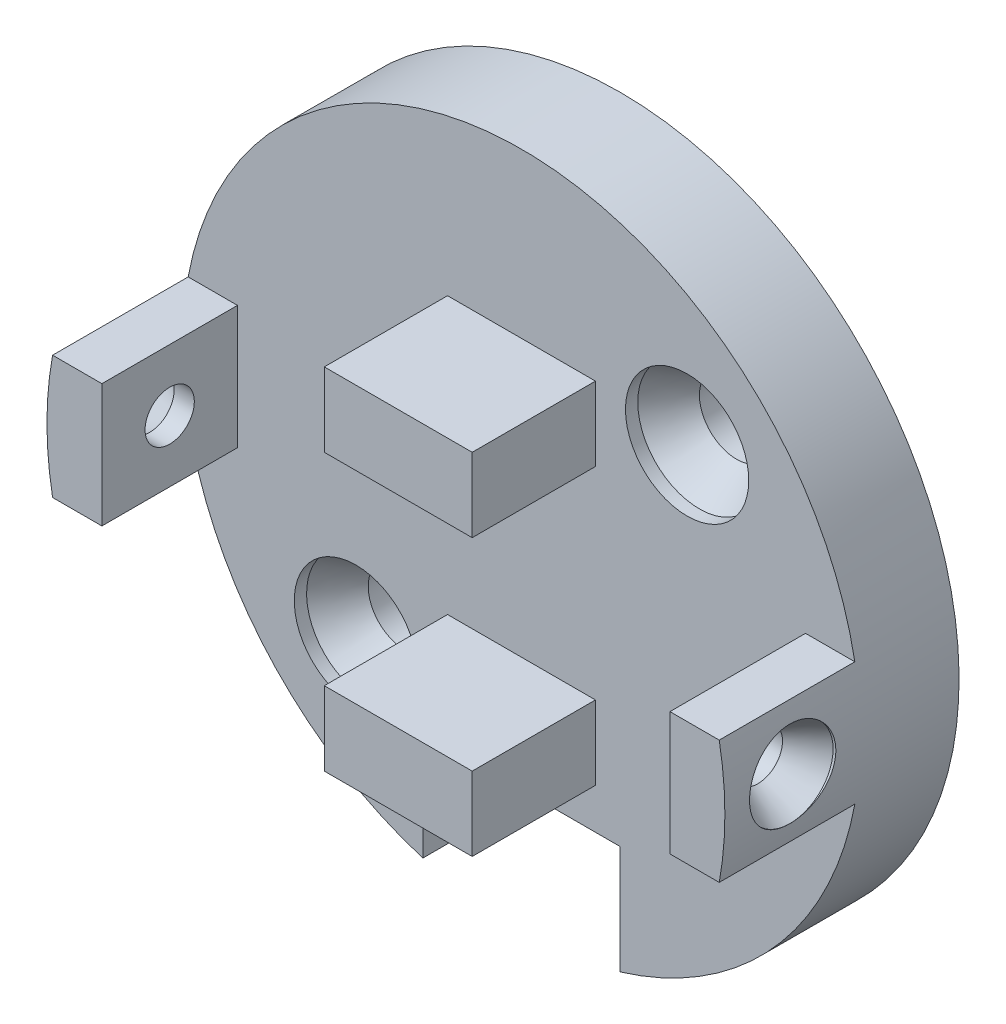
from build123d import *
from build123d.topology import SkipClean

# Parameters (mm, degrees)
SKETCH1_R           = 13.75
BOSS_EXTRUDE1_DEPTH = 4
BOSS_EXTRUDE2_DEPTH = 5.5
CIRPATTERN1_COUNT   = 2
CIRPATTERN1_ANGLE   = 180
CUT_EXTRUDE3_DEPTH  = 21.208290541
SKETCH12_W          = 6
SKETCH12_H          = 3
BOSS_EXTRUDE4_DEPTH = 5


with BuildPart() as part:
    # Sketch1 → Boss-Extrude1 (new body)
    with BuildSketch(Plane.XY):
        Circle(SKETCH1_R)
    extrude(amount=BOSS_EXTRUDE1_DEPTH)

    # Sketch2 → Boss-Extrude2 (add)
    with BuildSketch(Plane.XY.offset(4)):
        with BuildLine():
            Line((-11.520817283, 2.5), (-13.520817283, 2.5))
            ThreePointArc((-13.520817283, 2.5), (-13.75, 0), (-13.520817283, -2.5))
            Line((-13.520817283, -2.5), (-11.520817283, -2.5))
            Line((-11.520817283, -2.5), (-11.520817283, 2.5))
        make_face()
        with BuildLine():
            Line((11.520817283, -2.5), (13.520817283, -2.5))
            ThreePointArc((13.520817283, -2.5), (13.75, 0), (13.520817283, 2.5))
            Line((13.520817283, 2.5), (11.520817283, 2.5))
            Line((11.520817283, 2.5), (11.520817283, -2.5))
        make_face()
    extrude(amount=BOSS_EXTRUDE2_DEPTH)

    # Sketch6 → Cut-Revolve2 (revolve, cut)
    with BuildSketch(Plane.XY.offset(6.75)):
        Polygon((-12.338181697, 1), (-13.638181697, 1.75), (-15.174729208, 1.75), (-15.174729208, 0), (-11.520817283, 0), (-11.520817283, 1), align=None)
    cut_revolve2 = revolve(axis=Axis((-11.520817283, 0, 6.75), (-1, 0, 0)), mode=Mode.SUBTRACT)

    # CirPattern1: Cut-Revolve2 ×2 about axis
    with SkipClean():  # the faces are left unmerged after this step: merging them gives an invalid solid
        cirpattern1_axis = Axis((0, 0, 0), (0, 0, -1))
        for i in range(1, CIRPATTERN1_COUNT):
            add(cut_revolve2.rotate(cirpattern1_axis, i * CIRPATTERN1_ANGLE / (CIRPATTERN1_COUNT - 1)), mode=Mode.SUBTRACT)

    # Sketch10 → Cut-Revolve3 (revolve, cut)
    with SkipClean():  # the faces are left unmerged after this step: merging them gives an invalid solid
        with BuildSketch(Plane(origin=(0, 0, 0), x_dir=(-0.7071067811865561, -0.7071067811865389, 0), z_dir=(-0.7071067811865389, 0.7071067811865561, 0))):
            Polygon((-9.5, 0), (-8, 0), (-8, 2), (-7, 3.5), (-7, 4.049822385), (-9.5, 4.049822385), align=None)
        cut_revolve3 = revolve(axis=Axis((6.717514421, 6.717514421, 0), (0, 0, 1)), mode=Mode.SUBTRACT)

    # Mirror1: Cut-Revolve3 across plane
    with SkipClean():  # the faces are left unmerged after this step: merging them gives an invalid solid
        add(cut_revolve3.mirror(Plane(origin=(0, 0, 0), x_dir=(0, 0, 1), z_dir=(-0.7071067811865561, -0.7071067811865389, 0))), mode=Mode.SUBTRACT)

    # Sketch11 → Cut-Extrude3 (cut, through all)
    with SkipClean():  # the faces are left unmerged after this step: merging them gives an invalid solid
        with BuildSketch(Plane.XY.offset(4)):
            with BuildLine():
                ThreePointArc((-4, -13.155322117), (-2.021981816, -13.600517988), (-8e-09, -13.75))
                ThreePointArc((-8e-09, -13.75), (2.021981807, -13.600517989), (4, -13.155322117))
                Line((4, -13.155322117), (4, -8.75))
                Line((4, -8.75), (-4, -8.75))
                Line((-4, -8.75), (-4, -13.155322117))
            make_face()
        extrude(amount=-CUT_EXTRUDE3_DEPTH, mode=Mode.SUBTRACT)

    # Sketch12 → Boss-Extrude4 (add)
    with SkipClean():  # the faces are left unmerged after this step: merging them gives an invalid solid
        with BuildSketch(Plane.XY.offset(4)):
            with Locations((0, 5.6)):
                Rectangle(SKETCH12_W, SKETCH12_H)
            with Locations((0, -5.6)):
                Rectangle(SKETCH12_W, SKETCH12_H)
        extrude(amount=BOSS_EXTRUDE4_DEPTH)


solid = part.part
